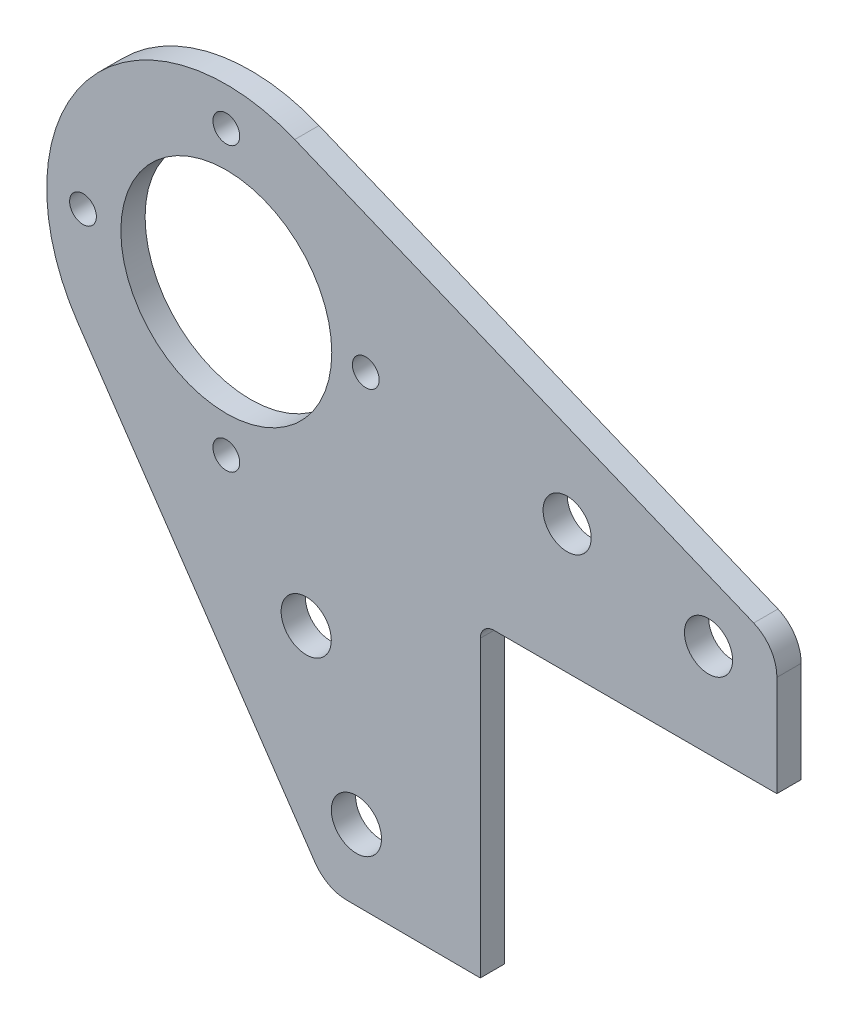
from build123d import *

# Parameters (mm, degrees)
SKETCH1_R          = 1.75
SKETCH1_R_2        = 13.8
BASE_FLANGE1_DEPTH = 3.175
SKETCH6_R          = 3.15
SKETCH6_R_2        = 3.282457618
CUT_EXTRUDE1_DEPTH = 128.736584442


# Sheet-metal steps are written as plain solids
with BuildPart() as part:
    # Sketch1 → Base-Flange1 (new body)
    with BuildSketch(Plane.XY):
        with BuildLine():
            Line((38.970667364, 0.451979476), (56.476339415, 0.364231306))
            Line((56.476339415, 0.364231306), (56.476339415, 38.864663006))
            ThreePointArc((56.476339415, 38.864663006), (57.009920449, 40.134796597), (58.285339291, 40.655617905))
            Line((58.285339291, 40.655617905), (95.285804475, 40.655617905))
            Line((95.285804475, 40.655617905), (95.285804475, 53.835620703))
            ThreePointArc((95.285804475, 53.835620703), (94.475239571, 56.617857644), (92.257476371, 58.483168407))
            Line((92.257476371, 58.483168407), (32.202639785, 83.238911906))
            ThreePointArc((32.202639785, 83.238911906), (5.007775741, 76.331219775), (3.813808252, 48.29818065))
            Line((3.813808252, 48.29818065), (34.861096289, 2.640368074))
            ThreePointArc((34.861096289, 2.640368074), (36.645617305, 1.038644509), (38.970667364, 0.451979476))
        make_face()
        with Locations((23.246582606, 43.012689186)):
            Circle(SKETCH1_R, mode=Mode.SUBTRACT)
        with Locations((4.493399578, 61.512456777)):
            Circle(SKETCH1_R, mode=Mode.SUBTRACT)
        with Locations((23.246582606, 80.012224369)):
            Circle(SKETCH1_R, mode=Mode.SUBTRACT)
        with Locations((41.492934761, 61.512456777)):
            Circle(SKETCH1_R, mode=Mode.SUBTRACT)
        with Locations((23.246582606, 61.512456777)):
            Circle(SKETCH1_R_2, mode=Mode.SUBTRACT)
    extrude(amount=-BASE_FLANGE1_DEPTH)

    # Sketch6 → Cut-Extrude1 (cut, through all)
    with BuildSketch(Plane.XY):
        with Locations((86.341786245, 52.887725453)):
            Circle(SKETCH6_R)
        with Locations((40.269797133, 9.667877899)):
            Circle(SKETCH6_R_2)
        with Locations((33.701172349, 28.884316382)):
            Circle(SKETCH6_R_2)
        with Locations((67.843667948, 57.502749994)):
            Circle(SKETCH6_R)
    extrude(amount=-CUT_EXTRUDE1_DEPTH, mode=Mode.SUBTRACT)


solid = part.part
